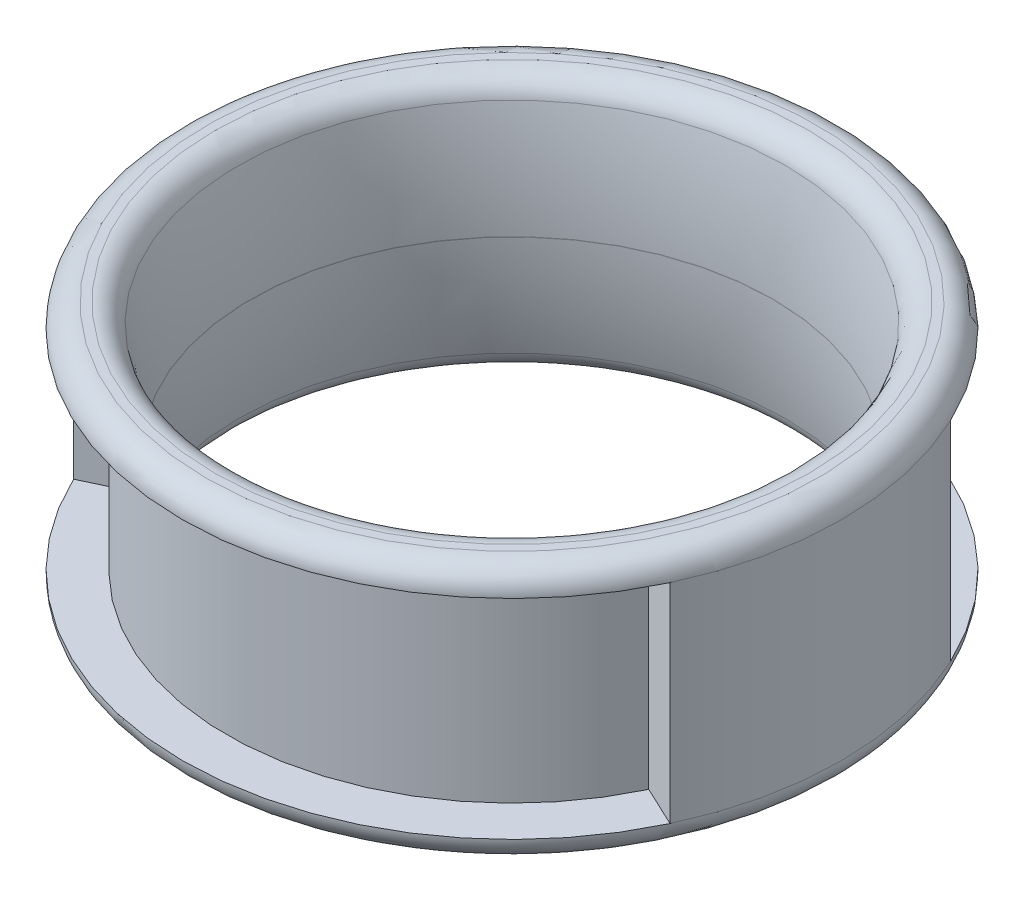
from build123d import *

# Parameters (mm, degrees)
BOSS_EXTRUDE1_DEPTH      = 3.75
BOSS_EXTRUDE1_DEPTH_BACK = 3.75
SKETCH1_R                = 9.635
SKETCH1_R_2              = 7.635
FILLET1_R                = 0.7
FILLET3_R                = 0.7
CUT_REVOLVE2_START       = -3.05
CUT_REVOLVE2_DEPTH       = 6.1


# Read off the part's stored shape, not the designer's step: Cut-Revolve2
with BuildPart() as part:
    # Sketch1 → Boss-Extrude1 (new, two sides: drawn at the far end of the back side and taken through both)
    with BuildSketch(Plane(origin=(0, 0, 0), x_dir=(1, 0, 0), z_dir=(0, 1, 0)).offset(-BOSS_EXTRUDE1_DEPTH_BACK)):
        with Locations(Location((0, 0, 0), (0, 0, 270))):
            Circle(SKETCH1_R)
        with Locations(Location((0, 0, 0), (0, 0, 270))):
            Circle(SKETCH1_R_2, mode=Mode.SUBTRACT)
    extrude(amount=BOSS_EXTRUDE1_DEPTH + BOSS_EXTRUDE1_DEPTH_BACK)

    # Fillet1
    fillet1_edges = [part.edges().sort_by_distance(p)[0] for p in [
        (0, -3.75, -9.635),
        (0, 3.75, -9.635),
    ]]
    fillet(fillet1_edges, radius=FILLET1_R)

    # Sketch3 → Cut-Revolve1 (revolve, cut)
    with BuildSketch(Plane(origin=(0, 0, 0), x_dir=(0, 0, -1), z_dir=(1, 0, 0)), mode=Mode.PRIVATE) as cut_revolve1_sk:
        with BuildLine():
            Line((-7.635, 3.75), (-7.635, 0.005))
            ThreePointArc((-7.635, 0.005), (-7.766616425, 1.893305551), (-8.135, 3.75))
            Line((-8.135, 3.75), (-7.635, 3.75))
        make_face()
        with BuildLine():
            Line((-7.635, -3.75), (-8.135, -3.75))
            ThreePointArc((-8.135, -3.75), (-7.766616425, -1.893305551), (-7.635, -0.005))
            Line((-7.635, -0.005), (-7.635, -3.75))
        make_face()
    revolve(cut_revolve1_sk.sketch.rotate(Axis((0, 0, 0), (0, 1, 0)), 180), axis=Axis((0, 0, 0), (0, 1, 0)), mode=Mode.SUBTRACT)

    # Fillet3
    fillet3_edges = [part.edges().sort_by_distance(p)[0] for p in [
        (0, 3.75, 8.135),
        (0, -3.75, 8.135),
    ]]
    fillet(fillet3_edges, radius=FILLET3_R)

    # Cut-Revolve2 outline → Cut-Revolve2 (cut)
    with BuildSketch(Plane(origin=(0, 0, 0), x_dir=(1, 0, 0), z_dir=(0, 1, 0)).offset(CUT_REVOLVE2_START)):
        with BuildLine():
            ThreePointArc((-7.543281251, 3.545579355), (0, 8.335), (7.543281251, 3.545579355))
            Line((7.543281251, 3.545579355), (8.719797823, 4.098579135))
            ThreePointArc((8.719797823, 4.098579135), (0, 9.635), (-8.719797823, 4.098579135))
            Line((-8.719797823, 4.098579135), (-7.543281251, 3.545579355))
        make_face()
    cut_revolve2 = extrude(amount=CUT_REVOLVE2_DEPTH, mode=Mode.SUBTRACT)

    # Mirror3: Cut-Revolve2 across plane
    add(cut_revolve2.mirror(Plane.XY), mode=Mode.SUBTRACT)


solid = part.part
